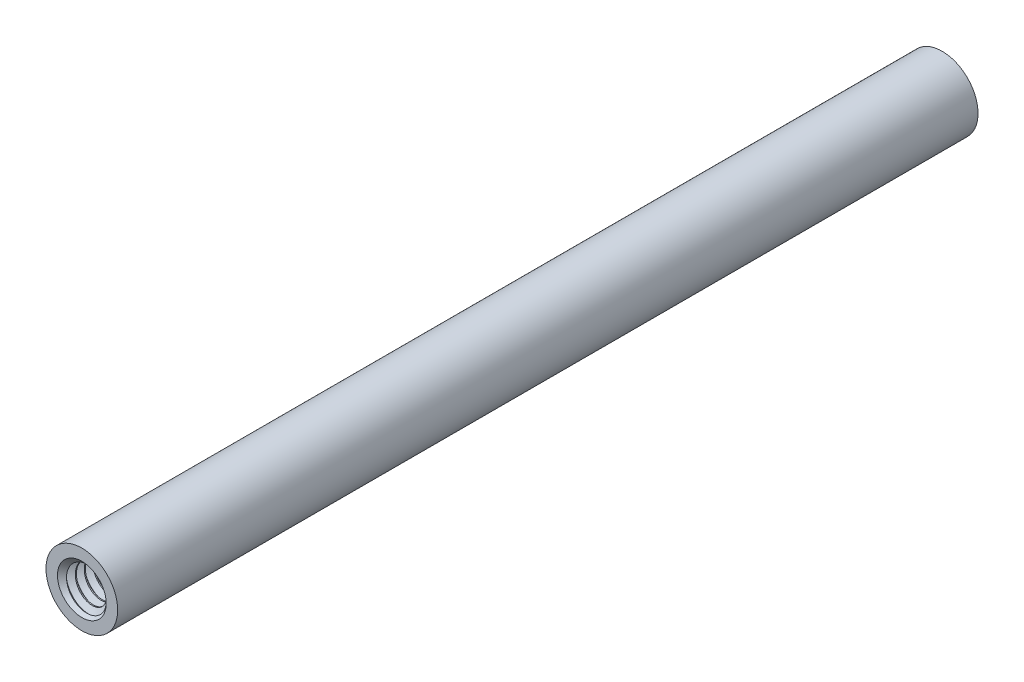
from build123d import *

# Parameters (mm, degrees)
BOSS_EXTRUDE1_START = 38.1
SKETCH13_R          = 2.0828
BOSS_EXTRUDE1_DEPTH = 11.1125
CUT_SWEEP1_PITCH    = 0.79375
CIRPATTERN1_COUNT   = 2
CIRPATTERN1_ANGLE   = 180
EXTRUDE1_DEPTH      = 38.1
EXTRUDE1_DEPTH_BACK = 38.1
SKETCH1_R           = 3.175


with BuildPart() as part:
    # Sketch13 → Boss-Extrude1 (new body)
    with BuildSketch(Plane.XY.offset(BOSS_EXTRUDE1_START)):
        Circle(SKETCH13_R)
    extrude(amount=-BOSS_EXTRUDE1_DEPTH)

    # Cut-Sweep1: the profile of Sketch15 profile screwed along a right-hand helix of 15 turns, 8 arcs to a turn; built about Z, then put on its axis
    cut_sweep1_z = Axis((0, 0, 0), (0, 0, 1))
    cut_sweep1_corners = [(2.0831, 0, -0.694704455), (2.0831, 0, 0.000173205), (1.567244252, 0, -0.29765625), (1.567244252, 0, -0.396875)]
    with BuildLine(mode=Mode.PRIVATE) as cut_sweep1_profile:
        Line(cut_sweep1_corners[0], cut_sweep1_corners[1])
        Line(cut_sweep1_corners[1], cut_sweep1_corners[2])
        Line(cut_sweep1_corners[2], cut_sweep1_corners[3])
        Line(cut_sweep1_corners[3], cut_sweep1_corners[0])
    cut_sweep1_cap = Face(cut_sweep1_profile.wire())
    cut_sweep1_turn_angles = [0, 22.5, 45, 67.5, 90, 112.5, 135, 157.5, 180, 202.5, 225, 247.5, 270, 292.5, 315, 337.5, 360]
    cut_sweep1_turn_weights = [1, 0.9238795325112867, 1, 0.9238795325112867, 1, 0.9238795325112867, 1, 0.9238795325112867, 1, 0.9238795325112867, 1, 0.9238795325112867, 1, 0.9238795325112867, 1, 0.9238795325112867, 1]
    cut_sweep1_turn_rails = [Edge.make_bspline([Vector(p[0], p[1], 0).rotate(cut_sweep1_z, cut_sweep1_turn_angles[k]) / cut_sweep1_turn_weights[k] + Vector(0, 0, p[2] + CUT_SWEEP1_PITCH * cut_sweep1_turn_angles[k] / 360) for k in range(17)], [0, 0, 0, 1, 1, 2, 2, 3, 3, 4, 4, 5, 5, 6, 6, 7, 7, 8, 8, 8], 2, cut_sweep1_turn_weights) for p in cut_sweep1_corners]
    cut_sweep1_turn_sides = [Face.make_surface_from_curves(cut_sweep1_turn_rails[p[0]], cut_sweep1_turn_rails[p[1]]) for p in [(0, 1), (1, 2), (2, 3), (3, 0)]]
    cut_sweep1 = Plane(origin=(0, 0, 38.1), x_dir=(0, 1, 0), z_dir=(0, 0, -1)) * Solid(Shell([*[p.moved(Location((0, 0, CUT_SWEEP1_PITCH * i))) for i in range(15) for p in cut_sweep1_turn_sides], cut_sweep1_cap, cut_sweep1_cap.rotate(cut_sweep1_z, 5400).moved(Location((0, 0, CUT_SWEEP1_PITCH * 5400 / 360)))]))
    add(cut_sweep1, mode=Mode.SUBTRACT)

    # Boss-Extrude2 cone 1 section (through the dimple's axis) → Boss-Extrude2 (revolve)
    with BuildSketch(Plane(origin=(0, 0, 38.1), x_dir=(0, -1, 0), z_dir=(1, 0, 0))):
        Polygon((0, 0), (2.159, 0), (0, 2.159), align=None)
    revolve(axis=Axis((0, 0, 38.1), (0, 0, -1)))


with BuildPart() as cirpattern1_1:
    # CirPattern1: pattern copy
    add(part.part.rotate(Axis((0, 3.175, 0), (0, -1, 0)), 1 * CIRPATTERN1_ANGLE / (CIRPATTERN1_COUNT - 1)))


with BuildPart() as body_3:
    # Sketch1 → Extrude1 (new, two sides: drawn at the far end of the back side and taken through both)
    with BuildSketch(Plane.XY.offset(-EXTRUDE1_DEPTH_BACK)):
        with Locations(Location((0, 0, 0), (0, 0, 180))):
            Circle(SKETCH1_R)
    extrude(amount=EXTRUDE1_DEPTH + EXTRUDE1_DEPTH_BACK)

    # Combine1: cut CirPattern1_1, part
    add(cirpattern1_1.part, mode=Mode.SUBTRACT)
    add(part.part, mode=Mode.SUBTRACT)


solid = body_3.part
